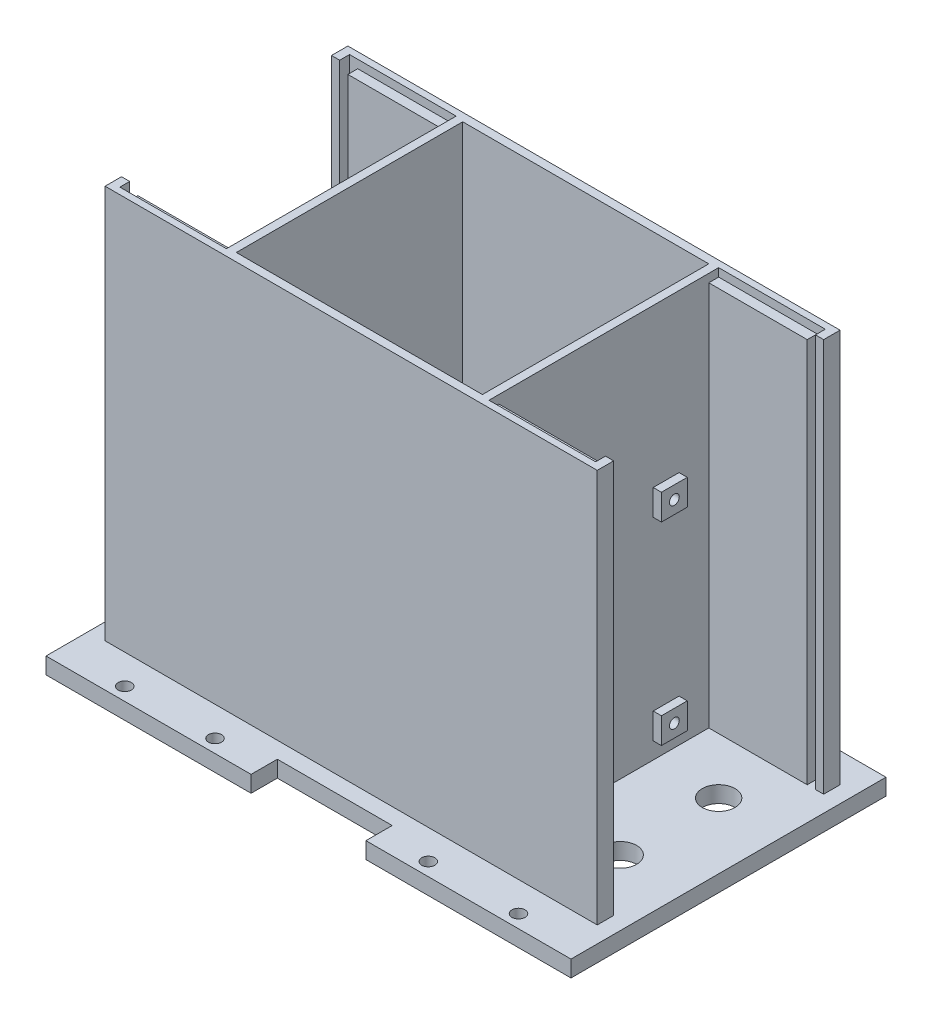
from build123d import *

# Parameters (mm, degrees)
SKETCH1_W               = 203.2
SKETCH1_H               = 203.2
BOSS_EXTRUDE1_DEPTH     = 6.35
SKETCH2_W               = 44.45
SKETCH2_H               = 45.72
SKETCH2_H_2             = 50.8
CUT_EXTRUDE1_DEPTH      = 144.824345992
SKETCH3_R               = 2.54
SKETCH3_W               = 25.4
SKETCH3_H               = 25.4
CUT_EXTRUDE2_DEPTH      = 6.35
MIRROR2_COPY_1_SKETCH_R = 2.54
MIRROR2_COPY_1_SKETCH_W = 25.4
MIRROR2_COPY_1_SKETCH_H = 25.4
MIRROR2_COPY_1_DEPTH    = 6.35
SKETCH4_W               = 101.6
SKETCH4_H               = 93.98
SKETCH4_W_2             = 95.25
SKETCH4_H_2             = 87.63
BOSS_EXTRUDE2_DEPTH     = 152.4
SKETCH5_W               = 10
SKETCH5_H               = 10
SKETCH5_R               = 1.6
BOSS_EXTRUDE3_DEPTH     = 3.175
CUT_EXTRUDE3_REACH      = 246.393
SKETCH8_R               = 1.905
SKETCH9_W               = 6.35
SKETCH9_H               = 152.4
BOSS_EXTRUDE4_DEPTH     = 44.45
SKETCH12_W              = 3.175
SKETCH12_H              = 3.81
CUT_EXTRUDE4_DEPTH      = 152.4
SKETCH13_W              = 38.1
SKETCH13_H              = 3.81
CUT_EXTRUDE5_DEPTH      = 3.175
SKETCH14_W              = 6.35
SKETCH14_H              = 152.4
BOSS_EXTRUDE5_DEPTH     = 44.45
SKETCH15_W              = 3.175
SKETCH15_H              = 3.81
CUT_EXTRUDE6_DEPTH      = 152.4
SKETCH16_W              = 38.1
SKETCH16_H              = 3.81
CUT_EXTRUDE7_DEPTH      = 3.175
CUT_EXTRUDE8_REACH      = 211.454
SKETCH17_R              = 6.35
MIRROR5_OUTLINE_R       = 6.35
MIRROR5_DEPTH           = 6.35
SKETCH18_W              = 79.375
SKETCH18_H              = 40.64
CUT_EXTRUDE9_DEPTH      = 210.453765781


# Read off the part's stored shape, not the designer's step: Mirror5
with BuildPart() as part:
    # Sketch1 → Boss-Extrude1 (new body)
    with BuildSketch(Plane(origin=(0, 0, 0), x_dir=(1, 0, 0), z_dir=(0, 1, 0))):
        Rectangle(SKETCH1_W, SKETCH1_H)
    extrude(amount=BOSS_EXTRUDE1_DEPTH)

    # Sketch2 → Cut-Extrude1 (cut, through all)
    with BuildSketch(Plane(origin=(0, 6.35, 0), x_dir=(1, 0, 0), z_dir=(0, 1, 0))):
        with Locations((0, 78.74)):
            Rectangle(SKETCH2_W, SKETCH2_H)
        with Locations((0, -76.2)):
            Rectangle(SKETCH2_W, SKETCH2_H_2)
    extrude(amount=-CUT_EXTRUDE1_DEPTH, mode=Mode.SUBTRACT)

    # Sketch3 → Cut-Extrude2 (cut)
    with BuildSketch(Plane(origin=(0, 6.35, 0), x_dir=(1, 0, 0), z_dir=(0, 1, 0))):
        with Locations(Location((-96.52, 76.2, 0), (0, 0, 270))):
            Circle(SKETCH3_R)
        with Locations(Location((-76.2, 96.52, 0), (0, 0, 270))):
            Circle(SKETCH3_R)
        with Locations(Location((-76.2, 55.88, 0), (0, 0, 270))):
            Circle(SKETCH3_R)
        with Locations(Location((-41.275, 96.52, 0), (0, 0, 270))):
            Circle(SKETCH3_R)
        with Locations(Location((-41.275, 55.88, 0), (0, 0, 90))):
            Circle(SKETCH3_R)
        with Locations((-41.148, 76.2)):
            Rectangle(SKETCH3_W, SKETCH3_H)
        with Locations((-76.2, 76.2)):
            Rectangle(SKETCH3_W, SKETCH3_H)
    cut_extrude2 = extrude(amount=-CUT_EXTRUDE2_DEPTH, mode=Mode.SUBTRACT)

    # Mirror1: Cut-Extrude2 across plane
    add(cut_extrude2.mirror(Plane(origin=(0, 0, 0), x_dir=(0, 0, 1), z_dir=(1, 0, 0))), mode=Mode.SUBTRACT)

    # Mirror2: Cut-Extrude2 across plane
    add(cut_extrude2.mirror(Plane.XY), mode=Mode.SUBTRACT)

    # Mirror2 copy 1 sketch → Mirror2 copy 1 (cut)
    with BuildSketch(Plane(origin=(0, 6.35, 0), x_dir=(-1, 0, 0), z_dir=(0, 1, 0))):
        with Locations(Location((-96.52, 76.2, 0), (0, 0, 270))):
            Circle(MIRROR2_COPY_1_SKETCH_R)
        with Locations(Location((-76.2, 96.52, 0), (0, 0, 270))):
            Circle(MIRROR2_COPY_1_SKETCH_R)
        with Locations(Location((-76.2, 55.88, 0), (0, 0, 270))):
            Circle(MIRROR2_COPY_1_SKETCH_R)
        with Locations(Location((-41.275, 96.52, 0), (0, 0, 270))):
            Circle(MIRROR2_COPY_1_SKETCH_R)
        with Locations(Location((-41.275, 55.88, 0), (0, 0, 90))):
            Circle(MIRROR2_COPY_1_SKETCH_R)
        with Locations((-41.148, 76.2)):
            Rectangle(MIRROR2_COPY_1_SKETCH_W, MIRROR2_COPY_1_SKETCH_H)
        with Locations((-76.2, 76.2)):
            Rectangle(MIRROR2_COPY_1_SKETCH_W, MIRROR2_COPY_1_SKETCH_H)
    extrude(amount=-MIRROR2_COPY_1_DEPTH, mode=Mode.SUBTRACT)

    # Sketch4 → Boss-Extrude2 (add)
    with BuildSketch(Plane(origin=(0, 6.35, 0), x_dir=(1, 0, 0), z_dir=(0, 1, 0))):
        with Locations((0, 2.54)):
            Rectangle(SKETCH4_W, SKETCH4_H)
        with Locations((0, 2.54)):
            Rectangle(SKETCH4_W_2, SKETCH4_H_2, mode=Mode.SUBTRACT)
    extrude(amount=BOSS_EXTRUDE2_DEPTH)

    # Sketch5 → Boss-Extrude3 (add)
    # profile 1 of 4: a face of its own
    with BuildSketch(Plane(origin=(50.8, 0, 0), x_dir=(0, 0, -1), z_dir=(1, 0, 0))):
        with Locations((-21.59, 93.98)):
            Rectangle(SKETCH5_W, SKETCH5_H)
        with Locations((-21.59, 93.98)):
            Circle(SKETCH5_R, mode=Mode.SUBTRACT)
    # profile 2 of 4: a face of its own
    with BuildSketch(Plane(origin=(50.8, 0, 0), x_dir=(0, 0, -1), z_dir=(1, 0, 0))):
        with Locations((26.67, 92.71)):
            Rectangle(SKETCH5_W, SKETCH5_H)
        with Locations((26.67, 92.71)):
            Circle(SKETCH5_R, mode=Mode.SUBTRACT)
    # profile 3 of 4: a face of its own
    with BuildSketch(Plane(origin=(50.8, 0, 0), x_dir=(0, 0, -1), z_dir=(1, 0, 0))):
        with Locations((-21.59, 11.43)):
            Rectangle(SKETCH5_W, SKETCH5_H)
        with Locations((-21.59, 11.43)):
            Circle(SKETCH5_R, mode=Mode.SUBTRACT)
    # profile 4 of 4: a face of its own
    with BuildSketch(Plane(origin=(50.8, 0, 0), x_dir=(0, 0, -1), z_dir=(1, 0, 0))):
        with Locations((26.67, 17.78)):
            Rectangle(SKETCH5_W, SKETCH5_H)
        with Locations((26.67, 17.78)):
            Circle(SKETCH5_R, mode=Mode.SUBTRACT)
    extrude(amount=BOSS_EXTRUDE3_DEPTH)

    # Sketch8 → Cut-Extrude3 (cut, up to next)
    with BuildSketch(Plane(origin=(53.975, 0, 0), x_dir=(0, 0, -1), z_dir=(1, 0, 0)), mode=Mode.PRIVATE) as cut_extrude3_sk1:
        with Locations((-21.59, 93.98)):
            Circle(SKETCH8_R)
    cut_extrude3_tool1 = extrude(cut_extrude3_sk1.sketch, amount=-CUT_EXTRUDE3_REACH, mode=Mode.PRIVATE) & part.part
    # Sketch8 → Cut-Extrude3 (cut, up to next)
    with BuildSketch(Plane(origin=(53.975, 0, 0), x_dir=(0, 0, -1), z_dir=(1, 0, 0)), mode=Mode.PRIVATE) as cut_extrude3_sk2:
        with Locations((26.67, 92.71)):
            Circle(SKETCH8_R)
    cut_extrude3_tool2 = extrude(cut_extrude3_sk2.sketch, amount=-CUT_EXTRUDE3_REACH, mode=Mode.PRIVATE) & part.part
    # Sketch8 → Cut-Extrude3 (cut, up to next)
    with BuildSketch(Plane(origin=(53.975, 0, 0), x_dir=(0, 0, -1), z_dir=(1, 0, 0)), mode=Mode.PRIVATE) as cut_extrude3_sk3:
        with Locations((-21.59, 11.43)):
            Circle(SKETCH8_R)
    cut_extrude3_tool3 = extrude(cut_extrude3_sk3.sketch, amount=-CUT_EXTRUDE3_REACH, mode=Mode.PRIVATE) & part.part
    # Sketch8 → Cut-Extrude3 (cut, up to next)
    with BuildSketch(Plane(origin=(53.975, 0, 0), x_dir=(0, 0, -1), z_dir=(1, 0, 0)), mode=Mode.PRIVATE) as cut_extrude3_sk4:
        with Locations((26.67, 17.78)):
            Circle(SKETCH8_R)
    cut_extrude3_tool4 = extrude(cut_extrude3_sk4.sketch, amount=-CUT_EXTRUDE3_REACH, mode=Mode.PRIVATE) & part.part
    add(cut_extrude3_tool1.solids().sort_by_distance((53.975, 93.98, 21.59))[0], mode=Mode.SUBTRACT)
    add(cut_extrude3_tool2.solids().sort_by_distance((53.975, 92.71, -26.67))[0], mode=Mode.SUBTRACT)
    add(cut_extrude3_tool3.solids().sort_by_distance((53.975, 11.43, 21.59))[0], mode=Mode.SUBTRACT)
    add(cut_extrude3_tool4.solids().sort_by_distance((53.975, 17.78, -26.67))[0], mode=Mode.SUBTRACT)

    # Sketch9 → Boss-Extrude4 (add)
    with BuildSketch(Plane(origin=(50.8, 0, 0), x_dir=(0, 0, -1), z_dir=(1, 0, 0))):
        with Locations((-41.275, 82.55)):
            Rectangle(SKETCH9_W, SKETCH9_H)
        with Locations((46.355, 82.55)):
            Rectangle(SKETCH9_W, SKETCH9_H)
    extrude(amount=BOSS_EXTRUDE4_DEPTH)

    # Sketch12 → Cut-Extrude4 (cut)
    with BuildSketch(Plane(origin=(0, 158.75, 0), x_dir=(1, 0, 0), z_dir=(0, 1, 0))):
        with Locations((90.4875, -40.005)):
            Rectangle(SKETCH12_W, SKETCH12_H)
    cut_extrude4 = extrude(amount=-CUT_EXTRUDE4_DEPTH, mode=Mode.SUBTRACT)

    # Sketch13 → Cut-Extrude5 (cut)
    with BuildSketch(Plane(origin=(0, 158.75, 0), x_dir=(1, 0, 0), z_dir=(0, 1, 0))):
        with Locations((69.85, -40.005)):
            Rectangle(SKETCH13_W, SKETCH13_H)
    cut_extrude5 = extrude(amount=-CUT_EXTRUDE5_DEPTH, mode=Mode.SUBTRACT)

    # Mirror3: Cut-Extrude4, Cut-Extrude5 across plane
    add(cut_extrude4.mirror(Plane(origin=(0, 0, -2.54), x_dir=(1, 0, 0), z_dir=(0, 0, -1))), mode=Mode.SUBTRACT)
    add(cut_extrude5.mirror(Plane(origin=(0, 0, -2.54), x_dir=(1, 0, 0), z_dir=(0, 0, -1))), mode=Mode.SUBTRACT)

    # Sketch14 → Boss-Extrude5 (add)
    with BuildSketch(Plane.ZY.offset(50.8)):
        with Locations((-46.355, 82.55)):
            Rectangle(SKETCH14_W, SKETCH14_H)
        with Locations((41.275, 82.55)):
            Rectangle(SKETCH14_W, SKETCH14_H)
    extrude(amount=BOSS_EXTRUDE5_DEPTH)

    # Sketch15 → Cut-Extrude6 (cut)
    with BuildSketch(Plane(origin=(0, 158.75, 0), x_dir=(1, 0, 0), z_dir=(0, 1, 0))):
        with Locations((-90.4875, -40.005)):
            Rectangle(SKETCH15_W, SKETCH15_H)
    cut_extrude6 = extrude(amount=-CUT_EXTRUDE6_DEPTH, mode=Mode.SUBTRACT)

    # Sketch16 → Cut-Extrude7 (cut)
    with BuildSketch(Plane(origin=(0, 158.75, 0), x_dir=(1, 0, 0), z_dir=(0, 1, 0))):
        with Locations((-69.85, -40.005)):
            Rectangle(SKETCH16_W, SKETCH16_H)
    cut_extrude7 = extrude(amount=-CUT_EXTRUDE7_DEPTH, mode=Mode.SUBTRACT)

    # Mirror4: Cut-Extrude6, Cut-Extrude7 across plane
    add(cut_extrude6.mirror(Plane(origin=(0, 0, -2.54), x_dir=(1, 0, 0), z_dir=(0, 0, -1))), mode=Mode.SUBTRACT)
    add(cut_extrude7.mirror(Plane(origin=(0, 0, -2.54), x_dir=(1, 0, 0), z_dir=(0, 0, -1))), mode=Mode.SUBTRACT)

    # Sketch17 → Cut-Extrude8 (cut, up to next)
    with BuildSketch(Plane(origin=(0, 6.35, 0), x_dir=(1, 0, 0), z_dir=(0, 1, 0)), mode=Mode.PRIVATE) as cut_extrude8_sk1:
        with Locations(Location((-76.2, -16.51, 0), (0, 0, 270))):
            Circle(SKETCH17_R)
    cut_extrude8_tool1 = extrude(cut_extrude8_sk1.sketch, amount=-CUT_EXTRUDE8_REACH, mode=Mode.PRIVATE) & part.part
    # Sketch17 → Cut-Extrude8 (cut, up to next)
    with BuildSketch(Plane(origin=(0, 6.35, 0), x_dir=(1, 0, 0), z_dir=(0, 1, 0)), mode=Mode.PRIVATE) as cut_extrude8_sk2:
        with Locations(Location((-76.2, 21.59, 0), (0, 0, 90))):
            Circle(SKETCH17_R)
    cut_extrude8_tool2 = extrude(cut_extrude8_sk2.sketch, amount=-CUT_EXTRUDE8_REACH, mode=Mode.PRIVATE) & part.part
    # Sketch17 → Cut-Extrude8 (cut, up to next)
    with BuildSketch(Plane(origin=(0, 6.35, 0), x_dir=(1, 0, 0), z_dir=(0, 1, 0)), mode=Mode.PRIVATE) as cut_extrude8_sk3:
        with Locations(Location((-28.575, 27.305, 0), (0, 0, 270))):
            Circle(SKETCH17_R)
    cut_extrude8_tool3 = extrude(cut_extrude8_sk3.sketch, amount=-CUT_EXTRUDE8_REACH, mode=Mode.PRIVATE) & part.part
    # Sketch17 → Cut-Extrude8 (cut, up to next)
    with BuildSketch(Plane(origin=(0, 6.35, 0), x_dir=(1, 0, 0), z_dir=(0, 1, 0)), mode=Mode.PRIVATE) as cut_extrude8_sk4:
        with Locations(Location((28.575, -22.225, 0), (0, 0, 270))):
            Circle(SKETCH17_R)
    cut_extrude8_tool4 = extrude(cut_extrude8_sk4.sketch, amount=-CUT_EXTRUDE8_REACH, mode=Mode.PRIVATE) & part.part
    add(cut_extrude8_tool1.solids().sort_by_distance((-76.2, 6.35, 16.51))[0], mode=Mode.SUBTRACT)
    add(cut_extrude8_tool2.solids().sort_by_distance((-76.2, 6.35, -21.59))[0], mode=Mode.SUBTRACT)
    add(cut_extrude8_tool3.solids().sort_by_distance((-28.575, 6.35, -27.305))[0], mode=Mode.SUBTRACT)
    add(cut_extrude8_tool4.solids().sort_by_distance((28.575, 6.35, 22.225))[0], mode=Mode.SUBTRACT)

    # Mirror5 outline → Mirror5 (cut)
    with BuildSketch(Plane(origin=(0, 0, 0), x_dir=(1, 0, 0), z_dir=(0, 1, 0))):
        with Locations((76.2, 21.59)):
            Circle(MIRROR5_OUTLINE_R)
        with Locations((76.2, -16.51)):
            Circle(MIRROR5_OUTLINE_R)
    extrude(amount=MIRROR5_DEPTH, mode=Mode.SUBTRACT)

    # Sketch18 → Cut-Extrude9 (cut, through all)
    with BuildSketch(Plane(origin=(0, 6.35, 0), x_dir=(1, 0, 0), z_dir=(0, 1, 0))):
        with Locations((-61.9125, 81.28)):
            Rectangle(SKETCH18_W, SKETCH18_H)
        with Locations((61.9125, 81.28)):
            Rectangle(SKETCH18_W, SKETCH18_H)
        with Locations((-61.9125, -81.28)):
            Rectangle(SKETCH18_W, SKETCH18_H)
        with Locations((61.9125, -81.28)):
            Rectangle(SKETCH18_W, SKETCH18_H)
    extrude(amount=-CUT_EXTRUDE9_DEPTH, mode=Mode.SUBTRACT)


solid = part.part
